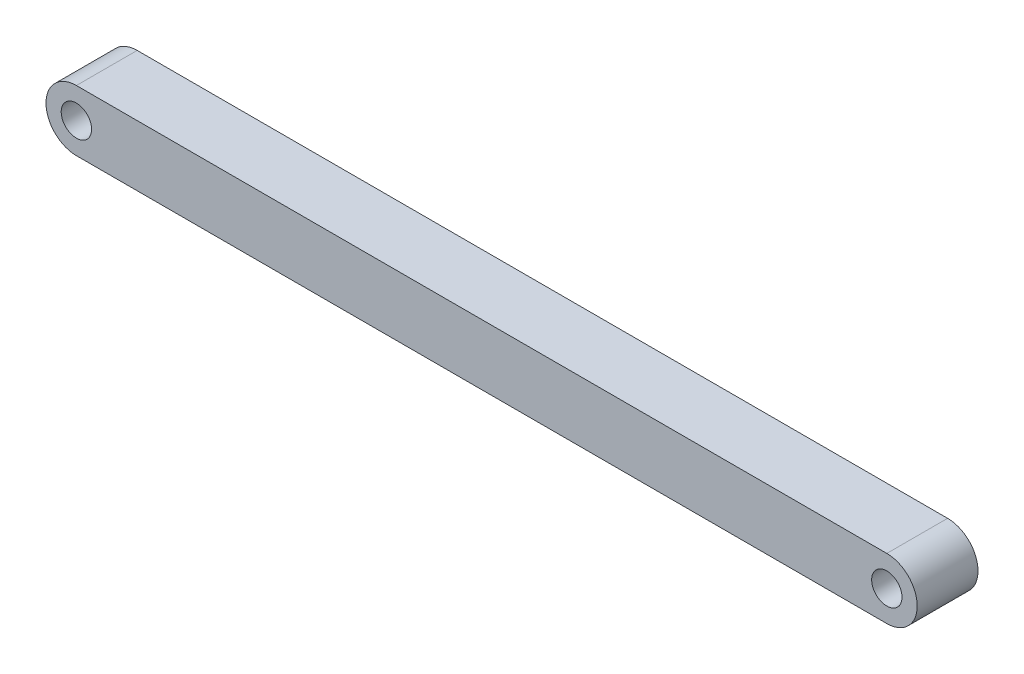
from build123d import *

# Parameters (mm, degrees)
BOSS_EXTRU_1_DEPTH      = 3
BOSS_EXTRU_1_DEPTH_BACK = 3
ESQUISSE1_R             = 1.5


with BuildPart() as part:
    # Esquisse1 → Boss.-Extru.1 (new, two sides: drawn at the far end of the back side and taken through both)
    with BuildSketch(Plane.XY.offset(-BOSS_EXTRU_1_DEPTH_BACK)):
        with BuildLine():
            Line((0, 3), (80, 3))
            ThreePointArc((80, 3), (83, 0), (80, -3))
            Line((80, -3), (0, -3))
            ThreePointArc((0, -3), (-3, 0), (0, 3))
        make_face()
        Circle(ESQUISSE1_R, mode=Mode.SUBTRACT)
        with Locations((80, 0)):
            Circle(ESQUISSE1_R, mode=Mode.SUBTRACT)
    extrude(amount=BOSS_EXTRU_1_DEPTH + BOSS_EXTRU_1_DEPTH_BACK)


solid = part.part
